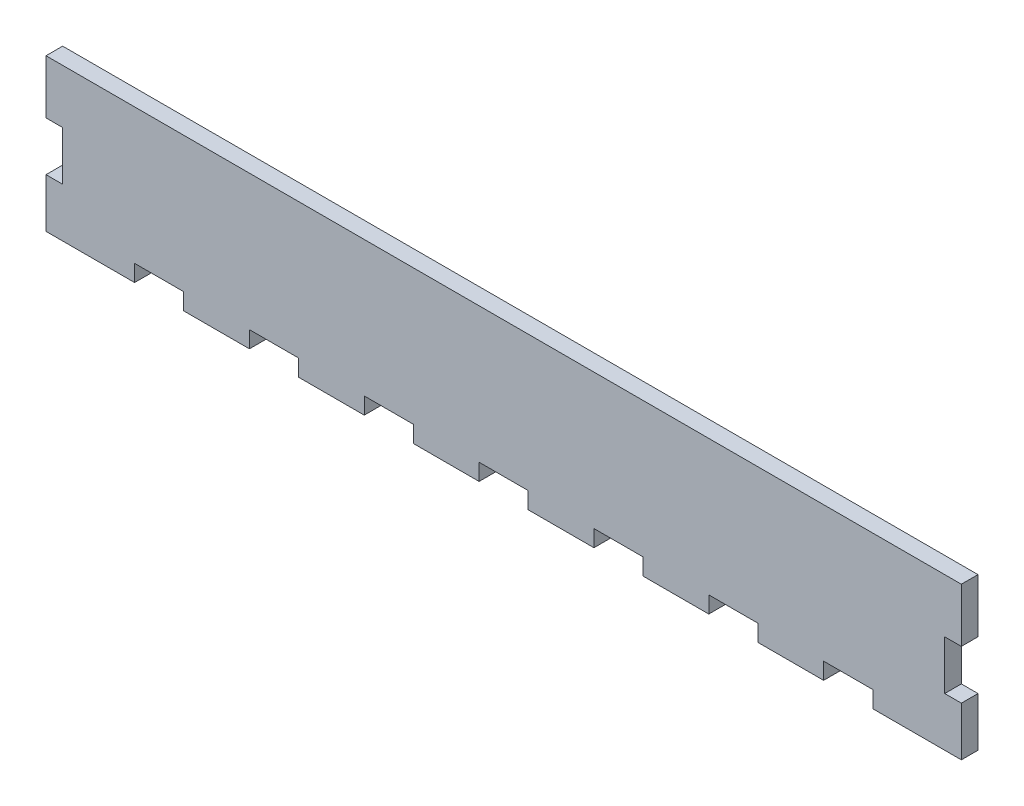
from build123d import *

# Parameters (mm, degrees)
BOSS_EXTRUDE1_DEPTH = 5.08


with BuildPart() as part:
    # Sketch27 → Boss-Extrude1 (new body)
    with BuildSketch(Plane.XY):
        Polygon((-5.08, -266.073056993), (21.963727505, -266.072990206), (21.963727505, -260.992990206), (36.963727505, -260.992990206), (36.963727505, -266.072990206), (57.015727505, -266.072990206), (57.015727505, -260.992990206), (72.015727505, -260.992990206), (72.015727505, -266.072990206), (92.067727505, -266.072990206), (92.067727505, -260.992990206), (107.067727505, -260.992990206), (107.067727505, -266.072990206), (127.119727505, -266.072990206), (127.119727505, -260.992990206), (142.119727505, -260.992990206), (142.119727505, -266.072990206), (162.171727505, -266.072990206), (162.171727505, -260.992990206), (177.171727505, -260.992990206), (177.171727505, -266.072990206), (197.223727505, -266.072990206), (197.223727505, -260.992990206), (212.223727505, -260.992990206), (212.223727505, -266.072990206), (232.275727505, -266.072990206), (232.275727505, -260.992990206), (247.275727505, -260.992990206), (247.275727505, -266.072990206), (274.32, -266.073056993), (274.32, -251.073056993), (269.24, -251.073056993), (269.24, -236.073056993), (274.32, -236.073056993), (274.32, -219.633947681), (-5.08, -219.633947681), (-5.08, -236.073056993), (0, -236.073056993), (0, -251.073056993), (-5.08, -251.073056993), align=None)
    extrude(amount=BOSS_EXTRUDE1_DEPTH)


solid = part.part
